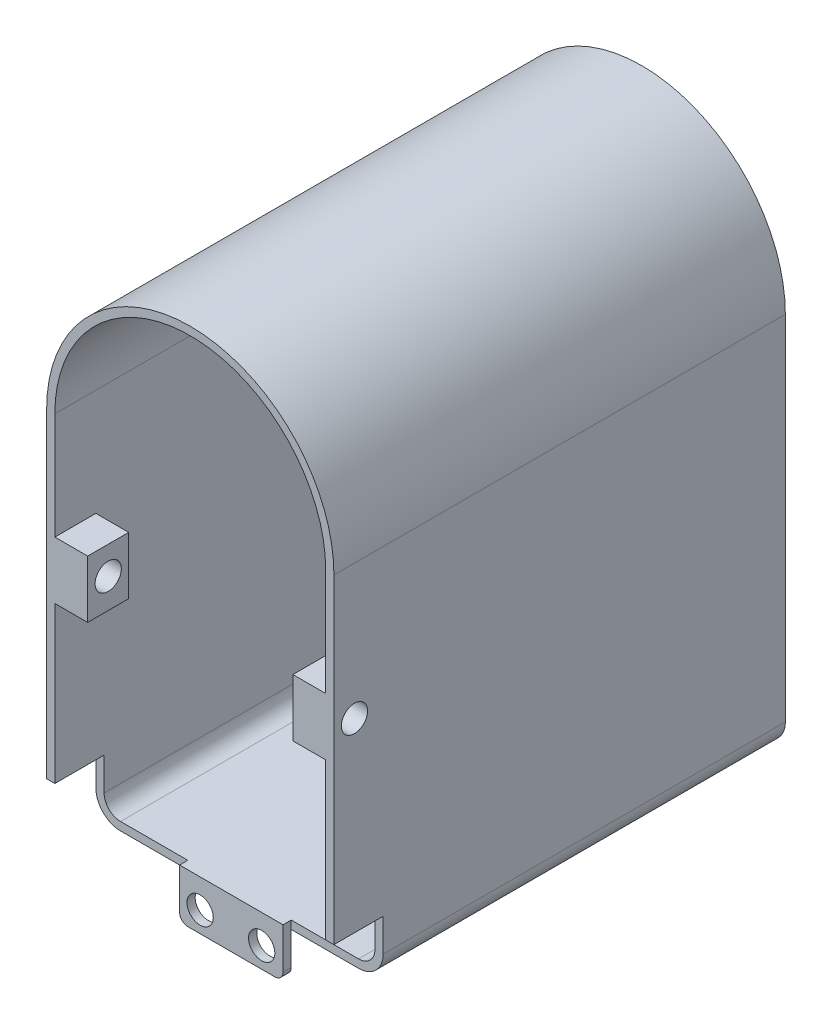
from build123d import *

# Parameters (mm, degrees)
EXTRUDE_1_DEPTH     = 55
FILLET_4_R          = 3
SHELL_1_T           = -1
SKETCH_3_W          = 35
SKETCH_3_H          = 6
CUT_EXTRUDE_2_DEPTH = 7
SKETCH_4_W          = 12.6
SKETCH_4_H          = 6
SKETCH_4_R          = 1.6
EXTRUDE_2_DEPTH     = 1
FILLET_5_R          = 1
SKETCH_5_W          = 5
SKETCH_5_H          = 7
EXTRUDE_3_DEPTH     = 5
SKETCH_7_R          = 1.6
CUT_EXTRUDE_3_DEPTH = 92.006867873


with BuildPart() as part:
    # 스케치1 → 보스-돌출1 (new body)
    with BuildSketch(Plane.XY):
        with BuildLine():
            Line((0, 0), (35, 0))
            Line((35, 0), (35, 46))
            ThreePointArc((35, 46), (17.5, 63.5), (0, 46))
            Line((0, 46), (0, 0))
        make_face()
    extrude(amount=EXTRUDE_1_DEPTH)

    # 필렛4
    fillet_4_edges = [part.edges().sort_by_distance(p)[0] for p in [
        (0, 0, 27.5),
        (35, 0, 27.5),
    ]]
    fillet(fillet_4_edges, radius=FILLET_4_R)

    # 쉘1
    shell_1_openings = [part.faces().sort_by_distance(p)[0] for p in [
        (17.5, 30.054194859, 55),
    ]]
    offset(amount=SHELL_1_T, openings=shell_1_openings, kind=Kind.INTERSECTION)

    # 스케치3 → 컷-돌출2 (cut)
    with BuildSketch(Plane.XZ):
        with Locations((17.5, 52)):
            Rectangle(SKETCH_3_W, SKETCH_3_H)
    extrude(amount=-CUT_EXTRUDE_2_DEPTH, mode=Mode.SUBTRACT)

    # 스케치4 → 보스-돌출2 (add)
    with BuildSketch(Plane.XY.offset(49)):
        with Locations((17.5, -2)):
            Rectangle(SKETCH_4_W, SKETCH_4_H)
        with Locations((13.7, -2.5)):
            Circle(SKETCH_4_R, mode=Mode.SUBTRACT)
        with Locations((21.2, -2.5)):
            Circle(SKETCH_4_R, mode=Mode.SUBTRACT)
    extrude(amount=EXTRUDE_2_DEPTH)

    # 필렛5
    fillet_5_edges = [part.edges().sort_by_distance(p)[0] for p in [
        (23.8, -5, 49.5),
        (11.2, -5, 49.5),
    ]]
    fillet(fillet_5_edges, radius=FILLET_5_R)

    # 스케치5 → 보스-돌출3 (add)
    with BuildSketch(Plane.XY.offset(55)):
        with Locations((2.5, 29.5)):
            Rectangle(SKETCH_5_W, SKETCH_5_H)
        with Locations((32.5, 29.5)):
            Rectangle(SKETCH_5_W, SKETCH_5_H)
    extrude(amount=-EXTRUDE_3_DEPTH)

    # 스케치7 → 컷-돌출3 (cut, through all)
    with BuildSketch(Plane.ZY):
        with Locations((52.5, 29.615)):
            Circle(SKETCH_7_R)
    extrude(amount=-CUT_EXTRUDE_3_DEPTH, mode=Mode.SUBTRACT)


solid = part.part
